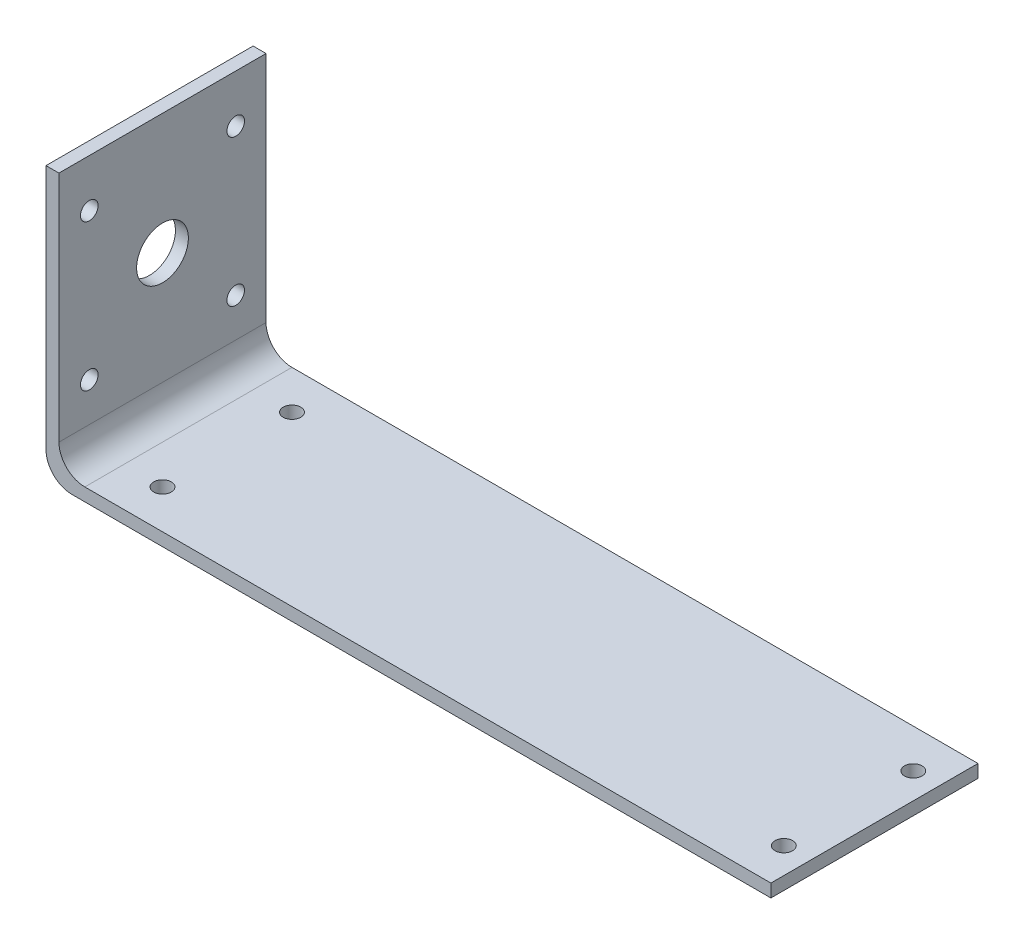
from build123d import *

# Parameters (mm, degrees)
SKETCH1_W               = 177.8
SKETCH1_H               = 50.8
BOSS_EXTRUDE1_DEPTH     = 3.175
SKETCH2_W               = 3.175
SKETCH2_H               = 50.8
BOSS_EXTRUDE2_DEPTH     = 63.5
FILLET1_R               = 6.35
F_1_0MM_DOWEL_HOLE1_D   = 4.318
F_1_0MM_DOWEL_HOLE2_D   = 12.7
ADVANCEDHOLE1_OUTLINE_R = 2.159
ADVANCEDHOLE1_DEPTH     = 3.175


# Read off the part's stored shape, not the designer's step: AdvancedHole1
with BuildPart() as part:
    # Sketch1 → Boss-Extrude1 (new body)
    with BuildSketch(Plane(origin=(0, 0, 0), x_dir=(1, 0, 0), z_dir=(0, 1, 0))):
        Rectangle(SKETCH1_W, SKETCH1_H)
    extrude(amount=BOSS_EXTRUDE1_DEPTH)

    # Sketch2 → Boss-Extrude2 (add)
    with BuildSketch(Plane(origin=(0, 3.175, 0), x_dir=(1, 0, 0), z_dir=(0, 1, 0))):
        with Locations((-87.3125, 0)):
            Rectangle(SKETCH2_W, SKETCH2_H)
    extrude(amount=BOSS_EXTRUDE2_DEPTH)

    # Fillet1
    fillet1_edges = [part.edges().sort_by_distance(p)[0] for p in [
        (-85.725, 3.175, 0),
        (-88.9, 0, 0),
    ]]
    fillet(fillet1_edges, radius=FILLET1_R)

    # Ø1.0mm Dowel Hole1 (through all)
    with Locations(Plane.ZY.offset(88.9)):
        with Locations((-17.960512212, 54.971024484), (17.960512272, 54.971024484), (17.960512272, 19.05), (-17.960512212, 19.05)):
            Hole(F_1_0MM_DOWEL_HOLE1_D / 2)

    # Ø1.0mm Dowel Hole2 (through all)
    with Locations(Plane(origin=(-88.9, 37.010512242, 3e-08), x_dir=(0, 0, -1), z_dir=(-1, 0, 0))):
        with Locations((0, 0)):
            Hole(F_1_0MM_DOWEL_HOLE2_D / 2)

    # AdvancedHole1 outline → AdvancedHole1 (cut)
    with BuildSketch(Plane(origin=(0, 0, 0), x_dir=(1, 0, 0), z_dir=(0, 1, 0))):
        with Locations((-69.85, -15.875)):
            Circle(ADVANCEDHOLE1_OUTLINE_R)
        with Locations((-69.85, 15.875)):
            Circle(ADVANCEDHOLE1_OUTLINE_R)
        with Locations((82.55, 15.875)):
            Circle(ADVANCEDHOLE1_OUTLINE_R)
        with Locations((82.55, -15.875)):
            Circle(ADVANCEDHOLE1_OUTLINE_R)
    extrude(amount=ADVANCEDHOLE1_DEPTH, mode=Mode.SUBTRACT)


solid = part.part
